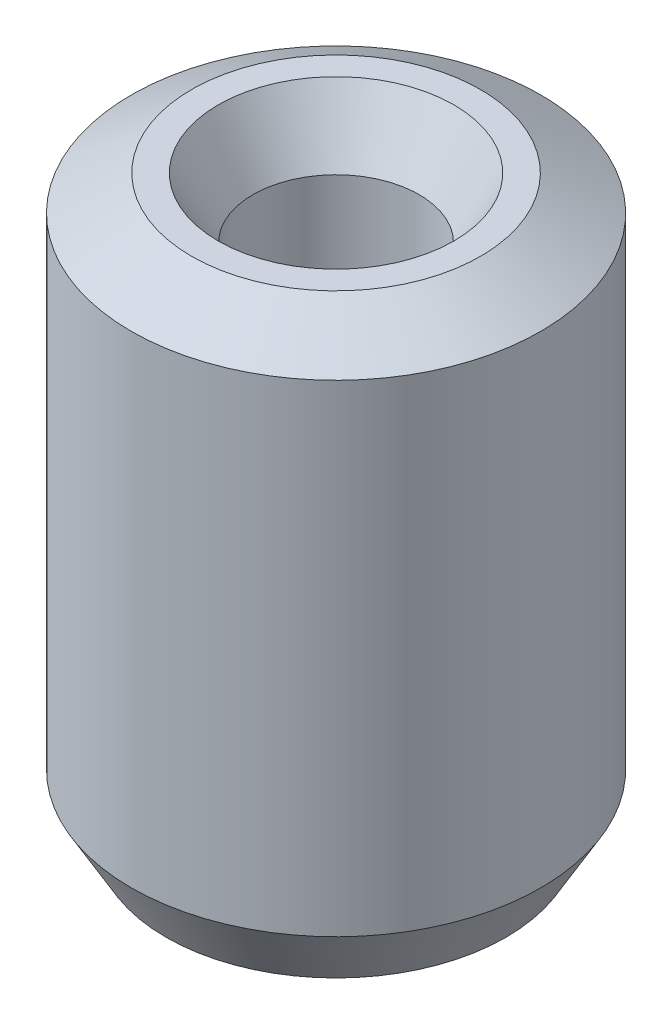
from build123d import *
from OCP.BRepFilletAPI import BRepFilletAPI_MakeChamfer

# Parameters (mm, degrees)
SKETCH1_R           = 17.5
BOSS_EXTRUDE1_DEPTH = 49.31511127
SKETCH2_R           = 7.101017376
CUT_EXTRUDE1_DEPTH  = 56.17680853
CHAMFER1_SIZE       = 2.975390551
CHAMFER1_SIZE2      = 5.153527607


with BuildPart() as part:
    # Sketch1 → Boss-Extrude1 (new body)
    with BuildSketch(Plane(origin=(0, 0, 0), x_dir=(1, 0, 0), z_dir=(0, 1, 0))):
        Circle(SKETCH1_R)
    extrude(amount=BOSS_EXTRUDE1_DEPTH)

    # Sketch2 → Cut-Extrude1 (cut, through all)
    with BuildSketch(Plane(origin=(0, 0, 0), x_dir=(1, 0, 0), z_dir=(0, 1, 0))):
        Circle(SKETCH2_R)
    extrude(amount=CUT_EXTRUDE1_DEPTH, mode=Mode.SUBTRACT)

    # Chamfer1: one chamfer whose edges measure the first distance from different faces: ONE call of the kernel's chamfer builder (chamfer() names one face for all edges)
    chamfer1_edges_1 = [part.edges().sort_by_distance(p)[0] for p in [
        (-7.101017376, 49.31511127, 0),
    ]]
    chamfer1_side_1 = [part.faces().sort_by_distance(p)[0] for p in [
        (-17.005025253, 49.31511127, 0),
    ]]
    chamfer1_edges_2 = [part.edges().sort_by_distance(p)[0] for p in [
        (-7.101017376, 0, 0),
    ]]
    chamfer1_side_2 = [part.faces().sort_by_distance(p)[0] for p in [
        (-7.101017376, 24.657555635, 0),
    ]]
    chamfer1_edges_3 = [part.edges().sort_by_distance(p)[0] for p in [
        (-17.5, 0, 0),
    ]]
    chamfer1_side_3 = [part.faces().sort_by_distance(p)[0] for p in [
        (-17.005025253, 0, 0),
    ]]
    chamfer1_edges_4 = [part.edges().sort_by_distance(p)[0] for p in [
        (-17.5, 49.31511127, 0),
    ]]
    chamfer1_side_4 = [part.faces().sort_by_distance(p)[0] for p in [
        (-17.5, 24.657555635, 0),
    ]]
    chamfer1 = BRepFilletAPI_MakeChamfer(part.part.solid().wrapped)
    for e in chamfer1_edges_1:
        chamfer1.Add(CHAMFER1_SIZE, CHAMFER1_SIZE2, e.wrapped, chamfer1_side_1[0].wrapped)  # the first distance lies on this face
    for e in chamfer1_edges_2:
        chamfer1.Add(CHAMFER1_SIZE, CHAMFER1_SIZE2, e.wrapped, chamfer1_side_2[0].wrapped)  # the first distance lies on this face
    for e in chamfer1_edges_3:
        chamfer1.Add(CHAMFER1_SIZE, CHAMFER1_SIZE2, e.wrapped, chamfer1_side_3[0].wrapped)  # the first distance lies on this face
    for e in chamfer1_edges_4:
        chamfer1.Add(CHAMFER1_SIZE, CHAMFER1_SIZE2, e.wrapped, chamfer1_side_4[0].wrapped)  # the first distance lies on this face
    add(Compound.cast(chamfer1.Shape()), mode=Mode.REPLACE)


solid = part.part
